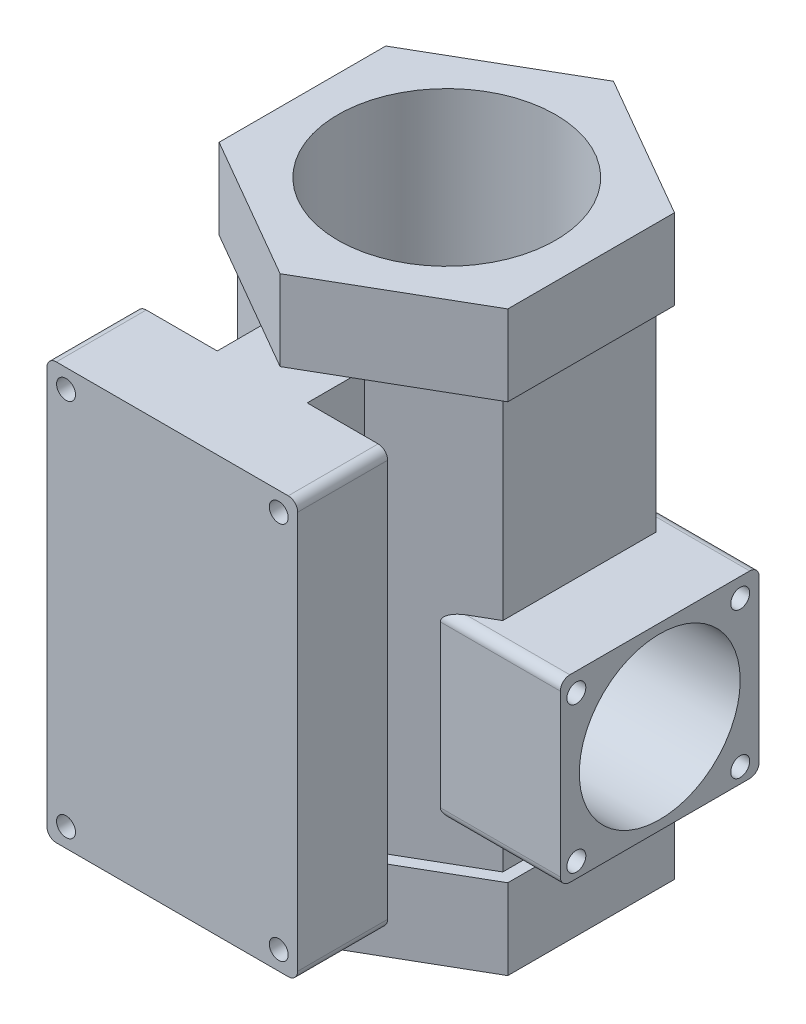
from build123d import *

# Parameters (mm, degrees)
EXTRUDE_1_DEPTH         = 85
EXTRUDE_706_DEPTH       = 440
EXTRUDE_2_DEPTH         = 85
EXTRUDE_1282_DEPTH      = 85
EXTRUDE_1282_DEPTH_BACK = 140
SKETCH_10_W             = 210
SKETCH_10_H             = 190
SKETCH_5_R              = 115
CUT_EXTRUDE_1344_DEPTH  = 712.91642768
CUT_EXTRUDE_1461_REACH  = 710.683
SKETCH_12_R             = 85
CUT_EXTRUDE_1628_REACH  = 739.219
SKETCH_13_R             = 10
SKETCH_14_R             = 10
CUT_EXTRUDE_6_DEPTH     = 30
FILLET_2_R              = 10
FILLET_3_R              = 10


with BuildPart() as part:
    # Эскиз2 → Боковой многогранник 1 (new body)
    with BuildSketch(Plane(origin=(0, 0, 0), x_dir=(1, 0, 0), z_dir=(0, 1, 0))):
        Polygon((0, 176.091832103), (-152.5, 88.045916051), (-152.5, -88.045916051), (0, -176.091832103), (152.5, -88.045916051), (152.5, 88.045916051), align=None)
    extrude(amount=EXTRUDE_1_DEPTH)

    # Sketch 338 → Extrude 706 (add)
    with BuildSketch(Plane(origin=(0, 0, 0), x_dir=(1, 0, 0), z_dir=(0, 1, 0))):
        Polygon((0, 161.658075373), (-140, 80.829037687), (-140, -80.829037687), (-47.5, -134.233937587), (-47.5, -195), (-132.5, -195), (-132.5, -290), (132.5, -290), (132.5, -195), (47.5, -195), (47.5, -134.233937587), (140, -80.829037687), (140, 80.829037687), align=None)
    extrude(amount=-EXTRUDE_706_DEPTH)

    # Эскиз4 → Боковой многогранник 2 (add)
    with BuildSketch(Plane.XZ.offset(440)):
        Polygon((0, -176.091832103), (152.5, -88.045916051), (152.5, 88.045916051), (0, 176.091832103), (-152.5, 88.045916051), (-152.5, -88.045916051), align=None)
    extrude(amount=EXTRUDE_2_DEPTH)

    # Эскиз10 → Extrude 1282 (add, two sides: drawn at the far end of the back side and taken through both)
    with BuildSketch(Plane(origin=(140, 0, 0), x_dir=(0, 0, -1), z_dir=(1, 0, 0)).offset(-EXTRUDE_1282_DEPTH_BACK)):
        with Locations((0, -305)):
            Rectangle(SKETCH_10_W, SKETCH_10_H)
    extrude(amount=EXTRUDE_1282_DEPTH + EXTRUDE_1282_DEPTH_BACK)

    # Эскиз5 → Cut-Extrude 1344 (cut, through all)
    with BuildSketch(Plane(origin=(0, 85, 0), x_dir=(1, 0, 0), z_dir=(0, 1, 0))):
        Circle(SKETCH_5_R)
    extrude(amount=-CUT_EXTRUDE_1344_DEPTH, mode=Mode.SUBTRACT)

    # Эскиз12 → Cut-Extrude 1461 (cut, up to next)
    with BuildSketch(Plane(origin=(225, 0, 0), x_dir=(0, 0, -1), z_dir=(1, 0, 0)), mode=Mode.PRIVATE) as cut_extrude_1461_sk1:
        with Locations((0, -305)):
            Circle(SKETCH_12_R)
    cut_extrude_1461_tool1 = extrude(cut_extrude_1461_sk1.sketch, amount=-CUT_EXTRUDE_1461_REACH, mode=Mode.PRIVATE) & part.part
    add(cut_extrude_1461_tool1.solids().sort_by_distance((225, -305, 0))[0], mode=Mode.SUBTRACT)

    # Эскиз13 → Cut-Extrude 1628 (cut, up to next)
    with BuildSketch(Plane.XY.offset(290), mode=Mode.PRIVATE) as cut_extrude_1628_sk1:
        with Locations((-112.232438193, -420.079427817)):
            Circle(SKETCH_13_R)
    cut_extrude_1628_tool1 = extrude(cut_extrude_1628_sk1.sketch, amount=-CUT_EXTRUDE_1628_REACH, mode=Mode.PRIVATE) & part.part
    # Эскиз13 → Cut-Extrude 1628 (cut, up to next)
    with BuildSketch(Plane.XY.offset(290), mode=Mode.PRIVATE) as cut_extrude_1628_sk2:
        with Locations((112.5, -420.079427817)):
            Circle(SKETCH_13_R)
    cut_extrude_1628_tool2 = extrude(cut_extrude_1628_sk2.sketch, amount=-CUT_EXTRUDE_1628_REACH, mode=Mode.PRIVATE) & part.part
    # Эскиз13 → Cut-Extrude 1628 (cut, up to next)
    with BuildSketch(Plane.XY.offset(290), mode=Mode.PRIVATE) as cut_extrude_1628_sk3:
        with Locations((-112.232438193, -20)):
            Circle(SKETCH_13_R)
    cut_extrude_1628_tool3 = extrude(cut_extrude_1628_sk3.sketch, amount=-CUT_EXTRUDE_1628_REACH, mode=Mode.PRIVATE) & part.part
    # Эскиз13 → Cut-Extrude 1628 (cut, up to next)
    with BuildSketch(Plane.XY.offset(290), mode=Mode.PRIVATE) as cut_extrude_1628_sk4:
        with Locations((112.5, -20)):
            Circle(SKETCH_13_R)
    cut_extrude_1628_tool4 = extrude(cut_extrude_1628_sk4.sketch, amount=-CUT_EXTRUDE_1628_REACH, mode=Mode.PRIVATE) & part.part
    add(cut_extrude_1628_tool1.solids().sort_by_distance((-112.232438, -420.079428, 290))[0], mode=Mode.SUBTRACT)
    add(cut_extrude_1628_tool2.solids().sort_by_distance((112.5, -420.079428, 290))[0], mode=Mode.SUBTRACT)
    add(cut_extrude_1628_tool3.solids().sort_by_distance((-112.232438, -20, 290))[0], mode=Mode.SUBTRACT)
    add(cut_extrude_1628_tool4.solids().sort_by_distance((112.5, -20, 290))[0], mode=Mode.SUBTRACT)

    # Эскиз14 → Вырез-Вытянуть6 (cut)
    with BuildSketch(Plane(origin=(225, 0, 0), x_dir=(0, 0, -1), z_dir=(1, 0, 0))):
        with Locations((85, -230)):
            Circle(SKETCH_14_R)
        with Locations((85, -384.038024849)):
            Circle(SKETCH_14_R)
        with Locations((-88.117212351, -230)):
            Circle(SKETCH_14_R)
        with Locations((-88.117212351, -384.038024849)):
            Circle(SKETCH_14_R)
    extrude(amount=-CUT_EXTRUDE_6_DEPTH, mode=Mode.SUBTRACT)

    # Скругление2
    fillet_2_edges = [part.edges().sort_by_distance(p)[0] for p in [
        (-132.5, -440, 242.5),
        (132.5, -440, 242.5),
        (-132.5, 0, 242.5),
        (132.5, 0, 242.5),
    ]]
    fillet(fillet_2_edges, radius=FILLET_2_R)

    # Скругление3
    fillet_3_edges = [part.edges().sort_by_distance(p)[0] for p in [
        (161.567332603, -210, -105),
        (161.567332603, -400, -105),
        (161.567332603, -400, 105),
        (161.567332603, -210, 105),
    ]]
    fillet(fillet_3_edges, radius=FILLET_3_R)


solid = part.part
